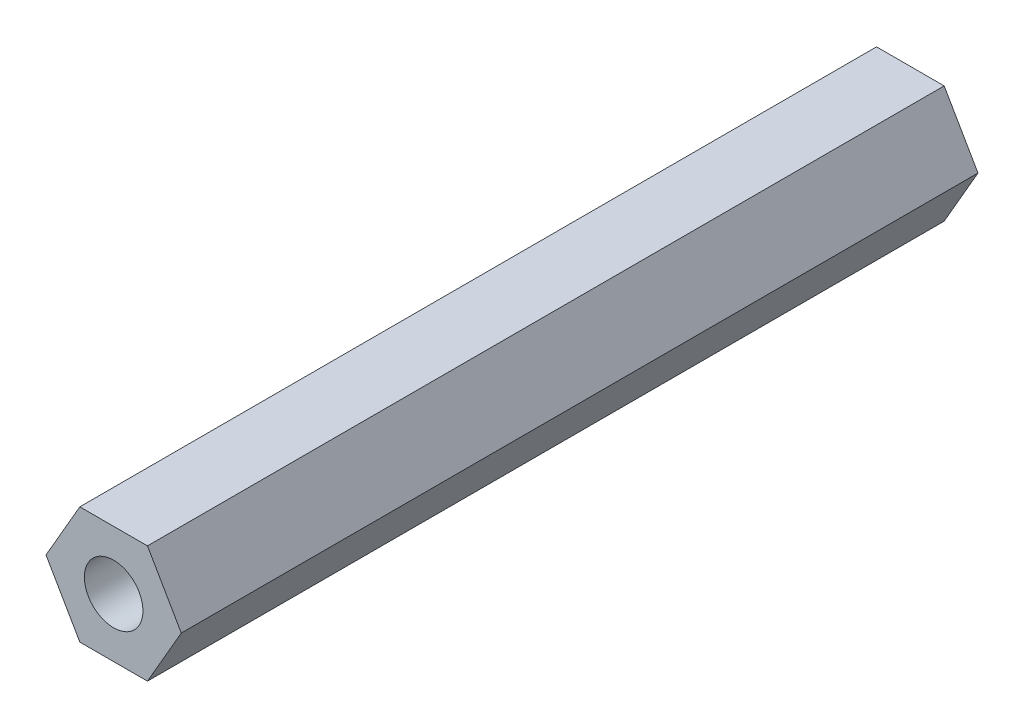
from build123d import *

# Parameters (mm, degrees)
SKETCH1_R           = 3.175
BOSS_EXTRUDE1_DEPTH = 43.18


with BuildPart() as part:
    # Sketch1 → Boss-Extrude1 (new, symmetric)
    with BuildSketch(Plane.XY):
        Polygon((3.666174209, 6.35), (-3.666174209, 6.35), (-7.332348419, 0), (-3.666174209, -6.35), (3.666174209, -6.35), (7.332348419, 0), align=None)
        Circle(SKETCH1_R, mode=Mode.SUBTRACT)
    extrude(amount=BOSS_EXTRUDE1_DEPTH, both=True)


solid = part.part
